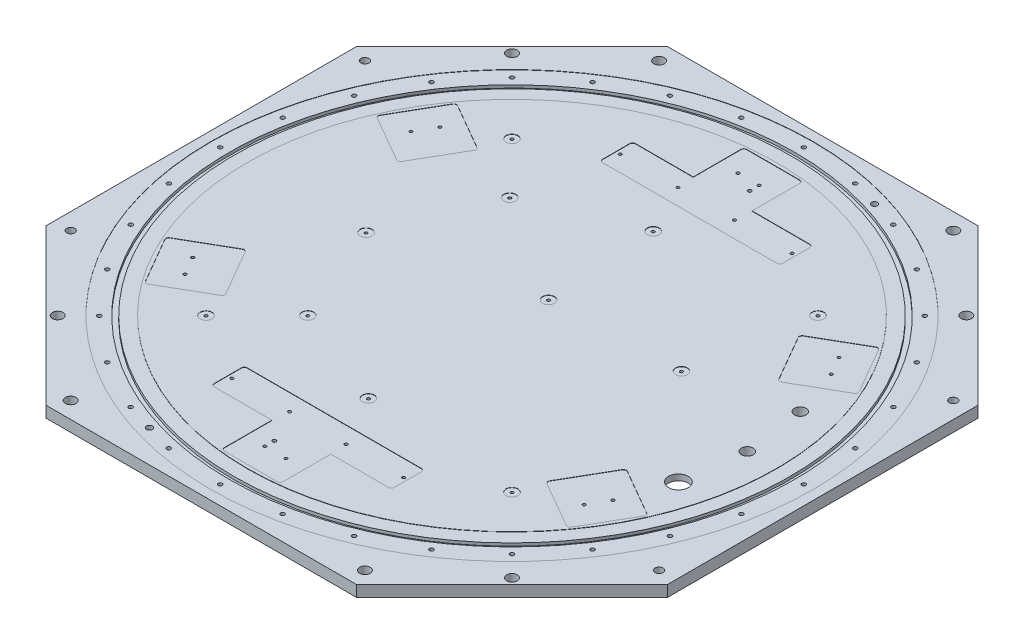
from build123d import *

# Parameters (mm, degrees)
BASE_PLATE_PROFILE_DEPTH         = 4.7625
SKETCH54_R                       = 256
SKETCH54_R_2                     = 225
CUT_EXTRUDE2_DEPTH               = 0.25
M3_CLEARANCE_HOLE1_D             = 3.4
F_5_0MM_DOWEL_HOLE1_D            = 5.05
F_5_0MM_DOWEL_HOLE1_DEPTH        = 5
F_5_0MM_DOWEL_HOLE1_TIP          = 1.517173063
SKETCH28_R                       = 240.5
SKETCH28_R_2                     = 236.3344
O_RING_GROOVE_DEPTH              = 2.413
CUT_EXTRUDE1_DEPTH               = 0.25
CIRPATTERN1_COUNT                = 6
M3X0_5_TAPPED_HOLE1_D            = 2.5
M3X0_5_TAPPED_HOLE1_DEPTH        = 7.5
M3X0_5_TAPPED_HOLE1_TIP          = 0.751075774
F_3_0MM_DOWEL_HOLE1_D            = 3
F_3_0MM_DOWEL_HOLE1_DEPTH        = 6
F_3_0MM_DOWEL_HOLE1_TIP          = 0.901290929
CUT_EXTRUDE3_DEPTH               = 0.25
CIRPATTERN2_COUNT                = 2
SKETCH57_R                       = 5
CUT_EXTRUDE4_DEPTH               = 0.25
SKETCH_PATTERN1_START            = 4.5125
SKETCH_PATTERN1_OUTLINE_R        = 5
SKETCH_PATTERN1_DEPTH            = 0.25
M3X0_5_TAPPED_HOLE2_D            = 2.5
M3X0_5_TAPPED_HOLE2_DEPTH        = 6.5
M3X0_5_TAPPED_HOLE2_TIP          = 0.751075774
M8X1_25_TAPPED_HOLE1_D           = 6.8
M8_CLEARANCE_HOLE_D              = 9
M8_CLEARANCE_HOLE1_D             = 9
F_7_16_20_TAPPED_HOLE1_D         = 9.92124
CIRPATTERN_EXTRACABLES_COUNT     = 2
F_5_8_CLEARANCE_HOLE_D           = 16.66748
F_5_8_CLEARANCE_HOLE_CBORE_D     = 35.999928
F_5_8_CLEARANCE_HOLE_CBORE_DEPTH = 4.499991


# Read off the part's stored shape, not the designer's step: M3x0.5 Tapped Hole4, Sketch-Pattern1
with BuildPart() as part:
    # Sketch1 → Base Plate Profile (new, symmetric)
    with BuildSketch(Plane(origin=(0, 0, 0), x_dir=(1, 0, 0), z_dir=(0, 1, 0))):
        Polygon((-131.979797464, 264), (131.979797464, 264), (264, 131.979797464), (264, -131.979797464), (131.979797464, -264), (-131.979797464, -264), (-264, -131.979797464), (-264, 131.979797464), align=None)
    extrude(amount=BASE_PLATE_PROFILE_DEPTH, both=True)

    # Sketch54 → Cut-Extrude2 (cut)
    with BuildSketch(Plane(origin=(0, 4.7625, 0), x_dir=(1, 0, 0), z_dir=(0, 1, 0))):
        with Locations(Location((0, 0, 0), (0, 0, 270))):
            Circle(SKETCH54_R)
        with Locations(Location((0, 0, 0), (0, 0, 270))):
            Circle(SKETCH54_R_2, mode=Mode.SUBTRACT)
    extrude(amount=-CUT_EXTRUDE2_DEPTH, mode=Mode.SUBTRACT)

    # M3 Clearance Hole1 (through all)
    with Locations(Plane(origin=(0, 4.5125, 0), x_dir=(1, 0, 0), z_dir=(0, 1, 0))):
        with Locations((248, 0), (243.23474954, -48.38239986), (229.122124063, -94.905491227), (206.204463851, -137.781417789), (175.362481734, -175.362481734), (137.781417789, -206.204463851), (94.905491227, -229.122124063), (48.38239986, -243.23474954), (0, -248), (-48.38239986, -243.23474954), (-94.905491227, -229.122124063), (-137.781417789, -206.204463851), (-175.362481734, -175.362481734), (-206.204463851, -137.781417789), (-229.122124063, -94.905491227), (-243.23474954, -48.38239986), (-248, 0), (-243.23474954, 48.38239986), (-229.122124063, 94.905491227), (-206.204463851, 137.781417789), (-175.362481734, 175.362481734), (-137.781417789, 206.204463851), (-94.905491227, 229.122124063), (-48.38239986, 243.23474954), (0, 248), (48.38239986, 243.23474954), (94.905491227, 229.122124063), (137.781417789, 206.204463851), (175.362481734, 175.362481734), (206.204463851, 137.781417789), (229.122124063, 94.905491227), (243.23474954, 48.38239986)):
            Hole(M3_CLEARANCE_HOLE1_D / 2)

    # Ø5.0mm Dowel Hole1
    with Locations(Plane(origin=(0, 4.5125, 0), x_dir=(1, 0, 0), z_dir=(0, 1, 0))):
        with Locations((71.700315282, 236.364262926), (-71.700315282, -236.364262926)):
            Hole(F_5_0MM_DOWEL_HOLE1_D / 2, depth=F_5_0MM_DOWEL_HOLE1_DEPTH)
            with Locations((0, 0, -(F_5_0MM_DOWEL_HOLE1_DEPTH + F_5_0MM_DOWEL_HOLE1_TIP / 2))):  # 118° drill point
                Cone(0, F_5_0MM_DOWEL_HOLE1_D / 2, F_5_0MM_DOWEL_HOLE1_TIP, mode=Mode.SUBTRACT)

    # Sketch28 → O-ring Groove (cut)
    with BuildSketch(Plane(origin=(0, 4.5125, 0), x_dir=(1, 0, 0), z_dir=(0, 1, 0))):
        with Locations(Location((0, 0, 0), (0, 0, 270))):
            Circle(SKETCH28_R)
        with Locations(Location((0, 0, 0), (0, 0, 270))):
            Circle(SKETCH28_R_2, mode=Mode.SUBTRACT)
    extrude(amount=-O_RING_GROOVE_DEPTH, mode=Mode.SUBTRACT)

    # Sketch52 → Cut-Extrude1 (cut)
    with BuildSketch(Plane(origin=(0, 4.7625, 0), x_dir=(1, 0, 0), z_dir=(0, 1, 0))):
        with BuildLine():
            Line((-22.5, 172), (22.5, 172))
            ThreePointArc((22.5, 172), (24.267766953, 172.732233047), (25, 174.5))
            Line((25, 174.5), (25, 219.5))
            ThreePointArc((25, 219.5), (24.267766953, 221.267766953), (22.5, 222))
            Line((22.5, 222), (-22.5, 222))
            ThreePointArc((-22.5, 222), (-24.267766953, 221.267766953), (-25, 219.5))
            Line((-25, 219.5), (-25, 174.5))
            ThreePointArc((-25, 174.5), (-24.267766953, 172.732233047), (-22.5, 172))
        make_face()
    cut_extrude1 = extrude(amount=-CUT_EXTRUDE1_DEPTH, mode=Mode.SUBTRACT)

    # CirPattern1: Cut-Extrude1 ×6 about axis
    cirpattern1_axis = Axis((0, 0, 0), (0, 1, 0))
    for i in range(1, CIRPATTERN1_COUNT):
        add(cut_extrude1.rotate(cirpattern1_axis, i * 360 / CIRPATTERN1_COUNT), mode=Mode.SUBTRACT)

    # M3x0.5 Tapped Hole1
    with Locations(Plane(origin=(0, 4.5125, 0), x_dir=(1, 0, 0), z_dir=(0, 1, 0))):
        with Locations((-9, 201), (9, 201), (169.571106161, 108.294228634), (178.571106161, 92.705771366), (178.571106161, -92.705771366), (169.571106161, -108.294228634), (9, -201), (-9, -201), (-169.571106161, -108.294228634), (-178.571106161, -92.705771366), (-178.571106161, 92.705771366), (-169.571106161, 108.294228634)):
            Hole(M3X0_5_TAPPED_HOLE1_D / 2, depth=M3X0_5_TAPPED_HOLE1_DEPTH)
            with Locations((0, 0, -(M3X0_5_TAPPED_HOLE1_DEPTH + M3X0_5_TAPPED_HOLE1_TIP / 2))):  # 118° drill point
                Cone(0, M3X0_5_TAPPED_HOLE1_D / 2, M3X0_5_TAPPED_HOLE1_TIP, mode=Mode.SUBTRACT)

    # Ø3.0mm Dowel Hole1
    with Locations(Plane(origin=(0, 4.5125, 0), x_dir=(1, 0, 0), z_dir=(0, 1, 0))):
        with Locations((9, 193), (-9, -193)):
            Hole(F_3_0MM_DOWEL_HOLE1_D / 2, depth=F_3_0MM_DOWEL_HOLE1_DEPTH)
            with Locations((0, 0, -(F_3_0MM_DOWEL_HOLE1_DEPTH + F_3_0MM_DOWEL_HOLE1_TIP / 2))):  # 118° drill point
                Cone(0, F_3_0MM_DOWEL_HOLE1_D / 2, F_3_0MM_DOWEL_HOLE1_TIP, mode=Mode.SUBTRACT)

    # Sketch55 → Cut-Extrude3 (cut)
    with BuildSketch(Plane(origin=(0, 4.7625, 0), x_dir=(1, 0, 0), z_dir=(0, 1, 0))):
        with BuildLine():
            Line((76.5, 153.5), (76.5, 176.5))
            ThreePointArc((76.5, 176.5), (75.767766953, 178.267766953), (74, 179))
            Line((74, 179), (-74, 179))
            ThreePointArc((-74, 179), (-75.767766953, 178.267766953), (-76.5, 176.5))
            Line((-76.5, 176.5), (-76.5, 153.5))
            ThreePointArc((-76.5, 153.5), (-75.767766953, 151.732233047), (-74, 151))
            Line((-74, 151), (74, 151))
            ThreePointArc((74, 151), (75.767766953, 151.732233047), (76.5, 153.5))
        make_face()
    cut_extrude3 = extrude(amount=-CUT_EXTRUDE3_DEPTH, mode=Mode.SUBTRACT)

    # CirPattern2: Cut-Extrude3 ×2 about axis
    cirpattern2_axis = Axis((0, 0, 0), (0, 1, 0))
    for i in range(1, CIRPATTERN2_COUNT):
        add(cut_extrude3.rotate(cirpattern2_axis, i * 360 / CIRPATTERN2_COUNT), mode=Mode.SUBTRACT)

    # M3x0.5 Tapped Hole4 outline → M3x0.5 Tapped Hole4 (revolve, cut)
    with BuildSketch(Plane(origin=(-24, 0, 165), x_dir=(1, 0, 0), z_dir=(0, 0, 1))):
        Polygon((0, 4.5125), (0, -3.488575774), (1.25, -2.7375), (1.25, 4.5125), align=None)
    revolve(axis=Axis((-24, 0, 165), (0, 1, 0)), mode=Mode.SUBTRACT)

    # M3x0.5 Tapped Hole4 2 outline → M3x0.5 Tapped Hole4 2 (revolve, cut)
    with BuildSketch(Plane(origin=(24, 0, 165), x_dir=(1, 0, 0), z_dir=(0, 0, 1))):
        Polygon((0, 4.5125), (0, -3.488575774), (1.25, -2.7375), (1.25, 4.5125), align=None)
    revolve(axis=Axis((24, 0, 165), (0, 1, 0)), mode=Mode.SUBTRACT)

    # M3x0.5 Tapped Hole4 3 outline → M3x0.5 Tapped Hole4 3 (revolve, cut)
    with BuildSketch(Plane(origin=(24, 0, -165), x_dir=(1, 0, 0), z_dir=(0, 0, 1))):
        Polygon((0, 4.5125), (0, -3.488575774), (1.25, -2.7375), (1.25, 4.5125), align=None)
    revolve(axis=Axis((24, 0, -165), (0, 1, 0)), mode=Mode.SUBTRACT)

    # M3x0.5 Tapped Hole4 4 outline → M3x0.5 Tapped Hole4 4 (revolve, cut)
    with BuildSketch(Plane(origin=(-24, 0, -165), x_dir=(1, 0, 0), z_dir=(0, 0, 1))):
        Polygon((0, 4.5125), (0, -3.488575774), (1.25, -2.7375), (1.25, 4.5125), align=None)
    revolve(axis=Axis((-24, 0, -165), (0, 1, 0)), mode=Mode.SUBTRACT)

    # M3x0.5 Tapped Hole4 5 outline → M3x0.5 Tapped Hole4 5 (revolve, cut)
    with BuildSketch(Plane(origin=(-73, 0, 165), x_dir=(1, 0, 0), z_dir=(0, 0, 1))):
        Polygon((0, 4.5125), (0, -3.488575774), (1.25, -2.7375), (1.25, 4.5125), align=None)
    revolve(axis=Axis((-73, 0, 165), (0, 1, 0)), mode=Mode.SUBTRACT)

    # M3x0.5 Tapped Hole4 6 outline → M3x0.5 Tapped Hole4 6 (revolve, cut)
    with BuildSketch(Plane(origin=(73, 0, 165), x_dir=(1, 0, 0), z_dir=(0, 0, 1))):
        Polygon((0, 4.5125), (0, -3.488575774), (1.25, -2.7375), (1.25, 4.5125), align=None)
    revolve(axis=Axis((73, 0, 165), (0, 1, 0)), mode=Mode.SUBTRACT)

    # M3x0.5 Tapped Hole4 7 outline → M3x0.5 Tapped Hole4 7 (revolve, cut)
    with BuildSketch(Plane(origin=(73, 0, -165), x_dir=(1, 0, 0), z_dir=(0, 0, 1))):
        Polygon((0, 4.5125), (0, -3.488575774), (1.25, -2.7375), (1.25, 4.5125), align=None)
    revolve(axis=Axis((73, 0, -165), (0, 1, 0)), mode=Mode.SUBTRACT)

    # M3x0.5 Tapped Hole4 8 outline → M3x0.5 Tapped Hole4 8 (revolve, cut)
    with BuildSketch(Plane(origin=(-73, 0, -165), x_dir=(1, 0, 0), z_dir=(0, 0, 1))):
        Polygon((0, 4.5125), (0, -3.488575774), (1.25, -2.7375), (1.25, 4.5125), align=None)
    revolve(axis=Axis((-73, 0, -165), (0, 1, 0)), mode=Mode.SUBTRACT)

    # Sketch57 → Cut-Extrude4 (cut)
    with BuildSketch(Plane(origin=(0, 4.7625, 0), x_dir=(1, 0, 0), z_dir=(0, 1, 0))):
        with Locations(Location((-130, -130, 0), (0, 0, 270))):
            Circle(SKETCH57_R)
    extrude(amount=-CUT_EXTRUDE4_DEPTH, mode=Mode.SUBTRACT)

    # Sketch-Pattern1 outline → Sketch-Pattern1 (cut)
    with BuildSketch(Plane(origin=(0, 0, 0), x_dir=(1, 0, 0), z_dir=(0, 1, 0)).offset(SKETCH_PATTERN1_START)):
        with Locations((113, 31)):
            Circle(SKETCH_PATTERN1_OUTLINE_R)
        with Locations((-2, 122)):
            Circle(SKETCH_PATTERN1_OUTLINE_R)
        with Locations((130, -130)):
            Circle(SKETCH_PATTERN1_OUTLINE_R)
        with Locations((130, 130)):
            Circle(SKETCH_PATTERN1_OUTLINE_R)
        with Locations((-130, 130)):
            Circle(SKETCH_PATTERN1_OUTLINE_R)
        with Locations((-86.8, -86.7)):
            Circle(SKETCH_PATTERN1_OUTLINE_R)
        with Locations((0, -122)):
            Circle(SKETCH_PATTERN1_OUTLINE_R)
        with Locations((-123, -1)):
            Circle(SKETCH_PATTERN1_OUTLINE_R)
        with Locations((-87.7, 85.8)):
            Circle(SKETCH_PATTERN1_OUTLINE_R)
        with Locations((4, 27)):
            Circle(SKETCH_PATTERN1_OUTLINE_R)
    extrude(amount=SKETCH_PATTERN1_DEPTH, mode=Mode.SUBTRACT)

    # M3x0.5 Tapped Hole2
    with Locations(Plane(origin=(0, 4.5125, 0), x_dir=(1, 0, 0), z_dir=(0, 1, 0))):
        with Locations((-130, -130), (130, -130), (130, 130), (-130, 130), (-86.8, -86.7), (0, -122), (-123, -1), (-87.7, 85.8), (4, 27), (-2, 122), (113, 31)):
            Hole(M3X0_5_TAPPED_HOLE2_D / 2, depth=M3X0_5_TAPPED_HOLE2_DEPTH)
            with Locations((0, 0, -(M3X0_5_TAPPED_HOLE2_DEPTH + M3X0_5_TAPPED_HOLE2_TIP / 2))):  # 118° drill point
                Cone(0, M3X0_5_TAPPED_HOLE2_D / 2, M3X0_5_TAPPED_HOLE2_TIP, mode=Mode.SUBTRACT)

    # M8x1.25 Tapped Hole1 (through all)
    with Locations(Plane(origin=(0, 4.7625, 0), x_dir=(1, 0, 0), z_dir=(0, 1, 0))):
        with Locations((250, 125), (-250, -125), (-250, 125), (250, -125)):
            Hole(M8X1_25_TAPPED_HOLE1_D / 2)

    # M8 Clearance Hole (through all)
    with Locations(Plane(origin=(-28.123925909, 4.7625, -48.06749493), x_dir=(1, 0, 0), z_dir=(0, 1, 0))):
        with Locations((-96.876074091, -298.06749493), (-96.876074091, 201.93250507), (153.123925909, -298.06749493), (153.123925909, 201.93250507)):
            Hole(M8_CLEARANCE_HOLE_D / 2)

    # M8 Clearance Hole1 (through all)
    with Locations(Plane(origin=(0, 4.7625, 0), x_dir=(1, 0, 0), z_dir=(0, 1, 0))):
        with Locations((-193.040151264, -193.040151264), (-193.040151264, 193.040151264), (193.040151264, 193.040151264), (193.040151264, -193.040151264)):
            Hole(M8_CLEARANCE_HOLE1_D / 2)

    # 7/16-20 Tapped Hole1 (through all)
    with Locations(Plane(origin=(0, -4.7625, 0), x_dir=(-1, 0, 0), z_dir=(0, -1, 0))):
        with Locations((-200, 0)):
            f_7_16_20_tapped_hole1 = Hole(F_7_16_20_TAPPED_HOLE1_D / 2)

    # CirPattern_extraCables: 7/16-20 Tapped Hole1 ×2 about axis
    cirpattern_extracables_axis = Axis((196.592582629, 0, -25.88190451), (0, 1, 0))
    for i in range(1, CIRPATTERN_EXTRACABLES_COUNT):
        add(f_7_16_20_tapped_hole1.rotate(cirpattern_extracables_axis, i * 360 / CIRPATTERN_EXTRACABLES_COUNT), mode=Mode.SUBTRACT)

    # 5/8 Clearance Hole (through all)
    with Locations(Plane.XZ.offset(4.7625)):
        with Locations((193.185165258, 51.763809021)):
            CounterBoreHole(F_5_8_CLEARANCE_HOLE_D / 2, F_5_8_CLEARANCE_HOLE_CBORE_D / 2, F_5_8_CLEARANCE_HOLE_CBORE_DEPTH)


solid = part.part
